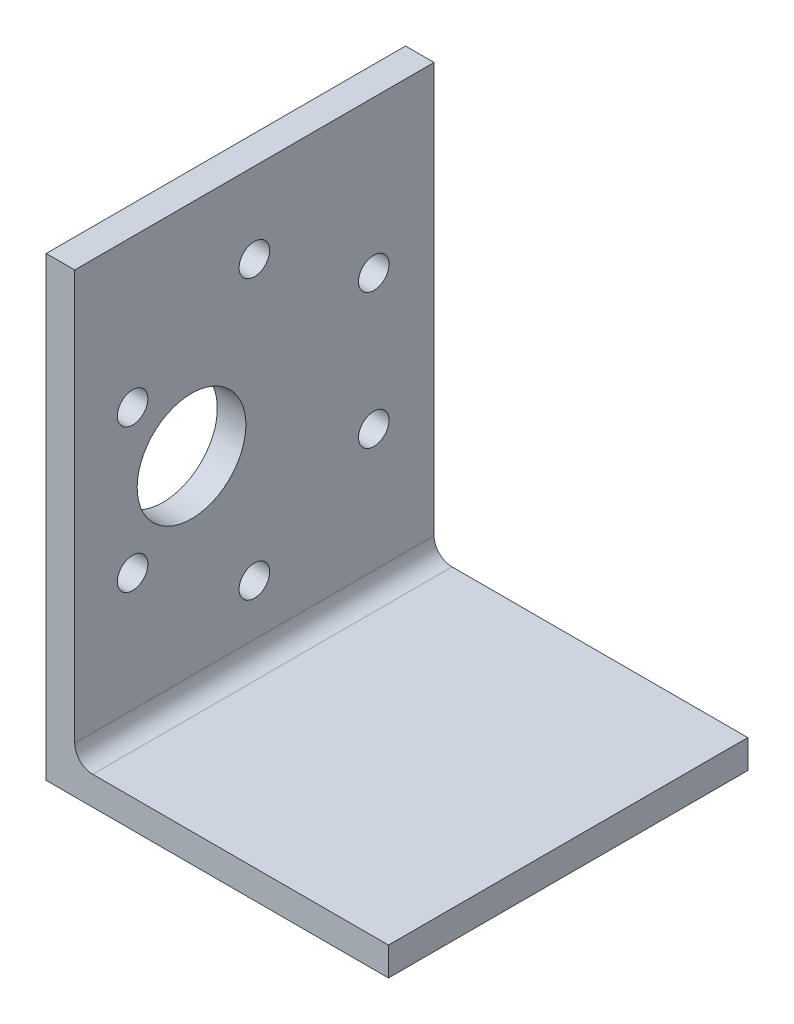
from build123d import *

# Parameters (mm, degrees)
BOSS_EXTRUDE1_DEPTH  = 20
FILLET1_R            = 2
M3_CLEARANCE_HOLE1_D = 3.4
SKETCH6_R            = 6.05
CUT_EXTRUDE1_DEPTH   = 67.575145512


with BuildPart() as part:
    # Sketch1 → Boss-Extrude1 (new, symmetric)
    with BuildSketch(Plane.XY):
        Polygon((0, 0), (0, 50.8), (3.175, 50.8), (3.175, 3.175), (38.1, 3.175), (38.1, 0), align=None)
    extrude(amount=BOSS_EXTRUDE1_DEPTH, both=True)

    # Fillet1
    fillet1_edges = [part.edges().sort_by_distance(p)[0] for p in [
        (3.175, 3.175, 0),
    ]]
    fillet(fillet1_edges, radius=FILLET1_R)

    # M3 Clearance Hole1 (through all)
    with Locations(Plane.ZY):
        with Locations((0, 41.847738991), (13.553804618, 34.328139243), (-13.289066718, 18.830400251), (0, 10.852261009), (-13.289066718, 33.869599749), (13.553804618, 18.371860757)):
            Hole(M3_CLEARANCE_HOLE1_D / 2)

    # Sketch6 → Cut-Extrude1 (cut, through all)
    with BuildSketch(Plane.ZY):
        with Locations((7, 26.35)):
            Circle(SKETCH6_R)
    extrude(amount=-CUT_EXTRUDE1_DEPTH, mode=Mode.SUBTRACT)


solid = part.part
